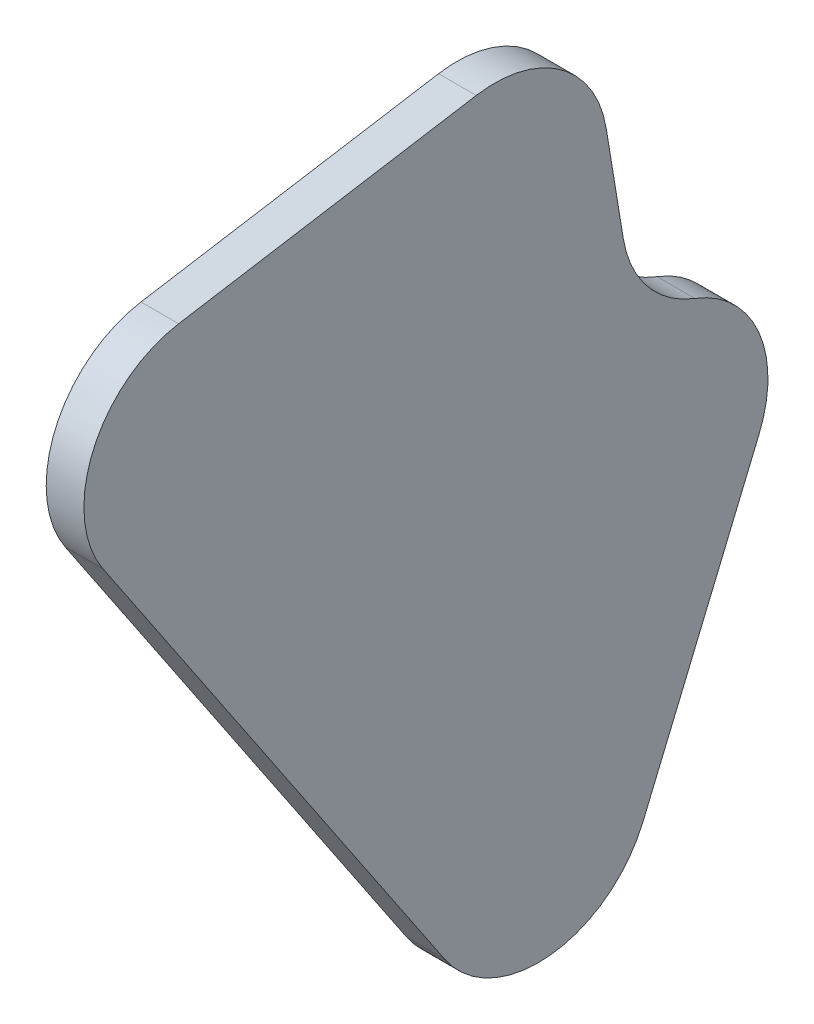
from build123d import *

# Parameters (mm, degrees)
BOSS_EXTRUDE1_START = 66.421062
BOSS_EXTRUDE1_DEPTH = 3.175
FILLET1_R           = 9.525


with BuildPart() as part:
    # Sketch1 → Boss-Extrude1 (new body)
    with BuildSketch(Plane(origin=(0, 0, 0), x_dir=(0, 0, -1), z_dir=(1, 0, 0)).offset(BOSS_EXTRUDE1_START)):
        with BuildLine():
            Line((-1123.745691864, 290.969312893), (-1113.943201538, 314.401580889))
            ThreePointArc((-1113.943201538, 314.401580889), (-1115.256946713, 323.982985548), (-1124.274989939, 327.476427692))
            Line((-1124.274989939, 327.476427692), (-1124.257483159, 327.479304887))
            Line((-1124.257483159, 327.479304887), (-1126.831962996, 343.144159772))
            ThreePointArc((-1126.831962996, 343.144159772), (-1130.677100149, 349.33776623), (-1137.77556383, 350.998384801))
            Line((-1137.77556383, 350.998384801), (-1162.839331646, 346.879217061))
            ThreePointArc((-1162.839331646, 346.879217061), (-1170.036672625, 341.262176157), (-1169.202400053, 332.170594614))
            Line((-1169.202400053, 332.170594614), (-1140.440548672, 289.335537249))
            ThreePointArc((-1140.440548672, 289.335537249), (-1131.605097766, 285.165531172), (-1123.745691864, 290.969312893))
        make_face()
    extrude(amount=BOSS_EXTRUDE1_DEPTH)

    # Fillet1
    # the kernel refuses this fillet: 9.525 mm, written as the material it adds along each edge
    with BuildSketch(Plane(origin=(66.421062, 327.476427692, 1124.274989939), x_dir=(0, -0.5830735725589627, -0.8124193553721674), z_dir=(1, 0, 0))) as fillet1_piece_1_section:
        with BuildLine():
            CenterArc((20.205576272, 6.735192091), FILLET1_R, 135, 90)
            Line((13.470384182, 13.470384182), (0, 0))
            ThreePointArc((0, 0), (6.735192091, 2.789807909), (13.470384182, 0))
        make_face()
    fillet1_piece_1 = extrude(amount=3.175, mode=Mode.PRIVATE)
    fillet1_piece_1 = split(fillet1_piece_1, bisect_by=Plane(origin=(68.008562, 327.479299996, 1124.257482355), z_dir=(0, -0.1621719582624188, 0.9867625124381917)), keep=Keep.TOP, mode=Mode.PRIVATE)
    add(fillet1_piece_1)
    # the kernel refuses this fillet: 9.525 mm, written as the material it adds along each edge
    with BuildSketch(Plane(origin=(69.596062, 327.479288583, 1124.257480479), x_dir=(0, 0.9867625124381958, 0.162171958262393), z_dir=(-1, 0, 0))) as fillet1_2_piece_1:
        with BuildLine():
            CenterArc((6.9625446, 9.525), FILLET1_R, 210.061634747, 59.938365253)
            ThreePointArc((-1.281219438, 4.753629183), (-0.328171819, 2.461024254), (0, 0))
            Line((0, 0), (6.9625446, 0))
        make_face()
    extrude(amount=3.175)


solid = part.part
